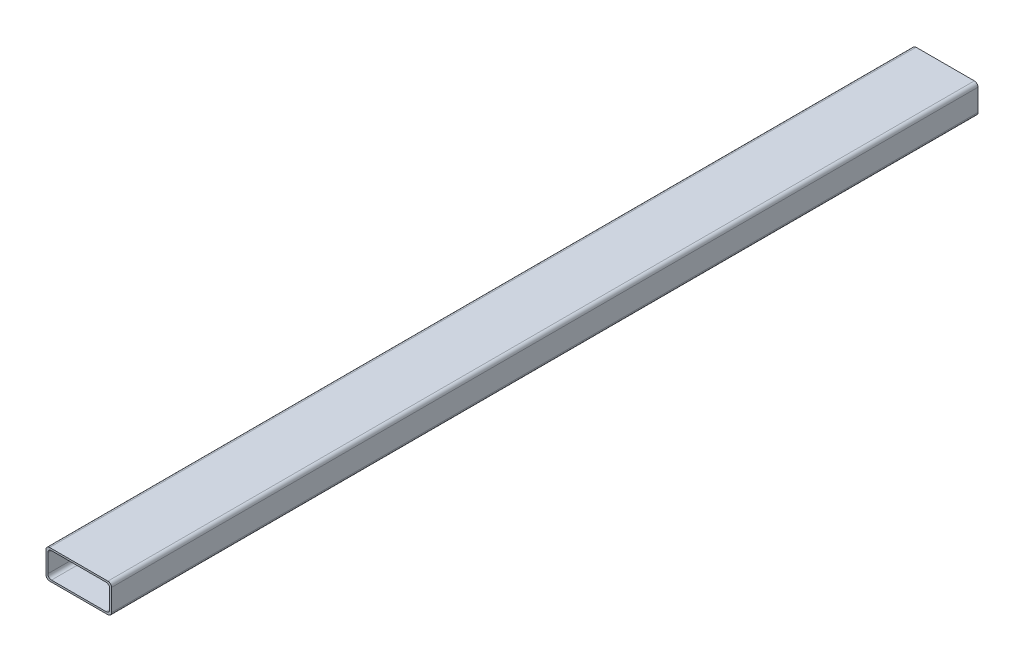
from build123d import *

# Parameters (mm, degrees)
SKETCH1_W           = 114.3
SKETCH1_H           = 50.8
SKETCH1_W_2         = 107.95
SKETCH1_H_2         = 44.45
BOSS_EXTRUDE1_DEPTH = 1511.3
FILLET1_R           = 6.35


with BuildPart() as part:
    # Sketch1 → Boss-Extrude1 (new body)
    with BuildSketch(Plane.XY):
        Rectangle(SKETCH1_W, SKETCH1_H)
        Rectangle(SKETCH1_W_2, SKETCH1_H_2, mode=Mode.SUBTRACT)
    extrude(amount=BOSS_EXTRUDE1_DEPTH)

    # Fillet1
    fillet1_edges = [part.edges().sort_by_distance(p)[0] for p in [
        (53.975, 22.225, 755.65),
        (53.975, -22.225, 755.65),
        (-53.975, -22.225, 755.65),
        (-53.975, 22.225, 755.65),
        (-57.15, -25.4, 755.65),
        (57.15, -25.4, 755.65),
        (-57.15, 25.4, 755.65),
        (57.15, 25.4, 755.65),
    ]]
    fillet(fillet1_edges, radius=FILLET1_R)


solid = part.part
